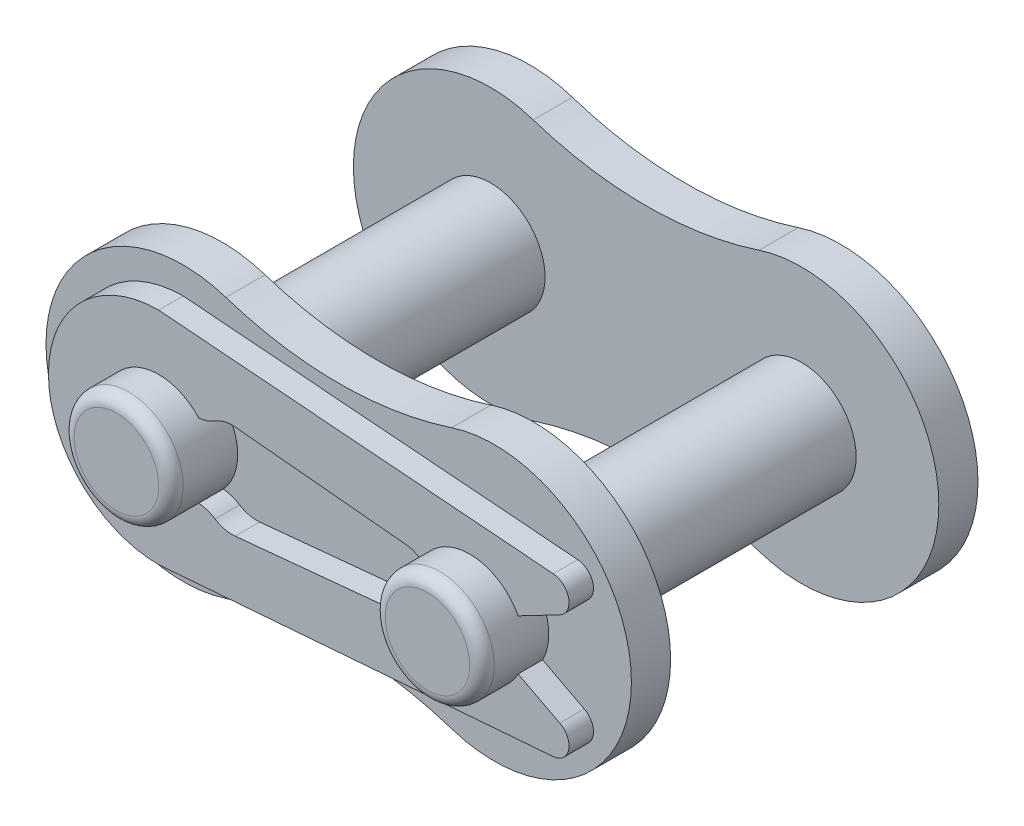
from build123d import *

# Parameters (mm, degrees)
BOSS_EXTRUDE1_START = 1.6
SKETCH3_R           = 2.225
BOSS_EXTRUDE1_DEPTH = 1.6
BOSS_EXTRUDE2_START = 1
BOSS_EXTRUDE2_DEPTH = 1


with BuildPart() as part:
    # Sketch1 → Revolve1 (revolve)
    with BuildSketch(Plane(origin=(0, 0, 0), x_dir=(1, 0, 0), z_dir=(0, 1, 0))):
        with BuildLine():
            Line((0, -9.8), (0, 8.4))
            ThreePointArc((0, 8.4), (1.73173504, 8.05565255), (3.2, 7.075))
            Line((3.2, 7.075), (2.225, 7.075))
            Line((2.225, 7.075), (2.225, -9.3))
            ThreePointArc((2.225, -9.3), (2.078553391, -9.653553391), (1.725, -9.8))
            Line((1.725, -9.8), (0, -9.8))
        make_face()
    revolve(axis=Axis((0, 0, -9.31), (0, 0, 1)))



with BuildPart() as body_2:
    # Sketch2 → Revolve2 (revolve)
    with BuildSketch(Plane.XZ):
        with BuildLine():
            Line((-12.7, 9.8), (-14.425, 9.8))
            ThreePointArc((-14.425, 9.8), (-14.778553391, 9.653553391), (-14.925, 9.3))
            Line((-14.925, 9.3), (-14.925, -7.075))
            Line((-14.925, -7.075), (-15.9, -7.075))
            ThreePointArc((-15.9, -7.075), (-14.43173504, -8.05565255), (-12.7, -8.4))
            Line((-12.7, -8.4), (-12.7, 9.8))
        make_face()
    revolve(axis=Axis((-12.7, 0, 9.8), (0, 0, -1)))


with BuildPart() as part_1:
    add(part.part)

    add(body_2.part)  # Boss-Extrude1 merges body 2
    # Sketch3 → Boss-Extrude1 (add)
    with BuildSketch(Plane(origin=(0, 0, -7.075), x_dir=(0, 1, 0), z_dir=(0, 0, 1)).offset(BOSS_EXTRUDE1_START)):
        with BuildLine():
            ThreePointArc((-5.32235114, 1.741429971), (0, -5.6), (5.32235114, 1.741429971))
            ThreePointArc((5.32235114, 1.741429971), (4.587573264, 6.35), (5.32235114, 10.958570029))
            ThreePointArc((5.32235114, 10.958570029), (0, 18.3), (-5.32235114, 10.958570029))
            ThreePointArc((-5.32235114, 10.958570029), (-4.587573264, 6.35), (-5.32235114, 1.741429971))
        make_face()
        Circle(SKETCH3_R, mode=Mode.SUBTRACT)
        with Locations((0, 12.7)):
            Circle(SKETCH3_R, mode=Mode.SUBTRACT)
    boss_extrude1 = extrude(amount=-BOSS_EXTRUDE1_DEPTH)

    # Mirror1: Boss-Extrude1 across plane
    add(boss_extrude1.mirror(Plane.XY))

    # Sketch4 → Boss-Extrude2 (add)
    with BuildSketch(Plane.XY.offset(7.075).offset(BOSS_EXTRUDE2_START)):
        with BuildLine():
            Line((3.407601441, 3.232304274), (-12.7, 4.5))
            ThreePointArc((-12.7, 4.5), (-17.2, 0), (-12.7, -4.5))
            Line((-12.7, -4.5), (3.407601441, -3.232304274))
            ThreePointArc((3.407601441, -3.232304274), (4.038627367, -2.674019694), (3.675904103, -1.913554557))
            Line((3.675904103, -1.913554557), (1.973599104, -1.027390664))
            ThreePointArc((1.973599104, -1.027390664), (0, -2.225), (-1.973599104, -1.027390664))
            Line((-1.973599104, -1.027390664), (-2.202654486, -1.146629349))
            ThreePointArc((-2.202654486, -1.146629349), (-2.380387754, -1.218438251), (-2.568557346, -1.255014714))
            Line((-2.568557346, -1.255014714), (-9.575400522, -1.929696974))
            ThreePointArc((-9.575400522, -1.929696974), (-10.002291503, -1.90004731), (-10.396428571, -1.733401027))
            ThreePointArc((-10.396428571, -1.733401027), (-10.715927718, -1.580255648), (-11.062434487, -1.50632141))
            ThreePointArc((-11.062434487, -1.50632141), (-14.925, 0), (-11.062434487, 1.50632141))
            ThreePointArc((-11.062434487, 1.50632141), (-10.715927718, 1.580255648), (-10.396428571, 1.733401027))
            ThreePointArc((-10.396428571, 1.733401027), (-10.002291503, 1.90004731), (-9.575400522, 1.929696974))
            Line((-9.575400522, 1.929696974), (-2.568557346, 1.255014714))
            ThreePointArc((-2.568557346, 1.255014714), (-2.380387754, 1.218438251), (-2.202654486, 1.146629349))
            Line((-2.202654486, 1.146629349), (-1.973599104, 1.027390664))
            ThreePointArc((-1.973599104, 1.027390664), (0, 2.225), (1.973599104, 1.027390664))
            Line((1.973599104, 1.027390664), (3.675904103, 1.913554557))
            ThreePointArc((3.675904103, 1.913554557), (4.038627367, 2.674019694), (3.407601441, 3.232304274))
        make_face()
    extrude(amount=-BOSS_EXTRUDE2_DEPTH)


solid = part_1.part
